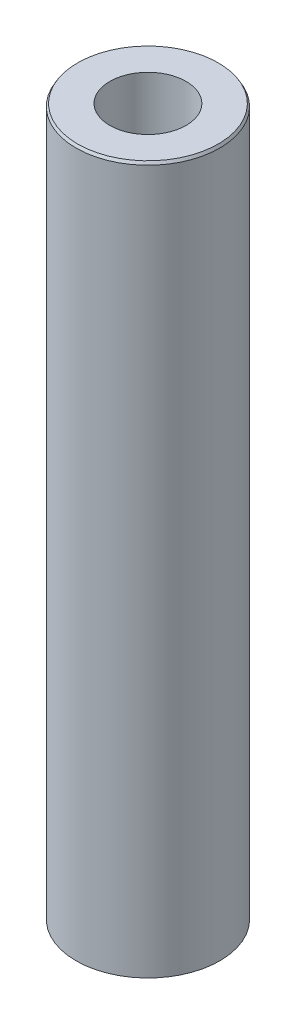
from build123d import *
from OCP.BRepFilletAPI import BRepFilletAPI_MakeChamfer

# Parameters (mm, degrees)
SKETCH1_R           = 47.5
BOSS_EXTRUDE1_DEPTH = 467.889511772
SKETCH2_R           = 25.213230245
CUT_EXTRUDE1_DEPTH  = 473.687100761
CHAMFER1_SIZE       = 1.798251149
CHAMFER1_SIZE2      = 1.038220785


with BuildPart() as part:
    # Sketch1 → Boss-Extrude1 (new body)
    with BuildSketch(Plane(origin=(0, 0, 0), x_dir=(1, 0, 0), z_dir=(0, 1, 0))):
        Circle(SKETCH1_R)
    extrude(amount=BOSS_EXTRUDE1_DEPTH)

    # Sketch2 → Cut-Extrude1 (cut, through all)
    with BuildSketch(Plane(origin=(0, 0, 0), x_dir=(1, 0, 0), z_dir=(0, 1, 0))):
        Circle(SKETCH2_R)
    extrude(amount=CUT_EXTRUDE1_DEPTH, mode=Mode.SUBTRACT)

    # Chamfer1: one chamfer whose edges measure the first distance from different faces: ONE call of the kernel's chamfer builder (chamfer() names one face for all edges)
    chamfer1_edges_1 = [part.edges().sort_by_distance(p)[0] for p in [
        (-47.5, 467.889511772, 0),
    ]]
    chamfer1_side_1 = [part.faces().sort_by_distance(p)[0] for p in [
        (-47.5, 233.944755886, 0),
    ]]
    chamfer1_edges_2 = [part.edges().sort_by_distance(p)[0] for p in [
        (-47.5, 0, 0),
    ]]
    chamfer1_side_2 = [part.faces().sort_by_distance(p)[0] for p in [
        (-46.156497116, 0, 0),
    ]]
    chamfer1 = BRepFilletAPI_MakeChamfer(part.part.solid().wrapped)
    for e in chamfer1_edges_1:
        chamfer1.Add(CHAMFER1_SIZE, CHAMFER1_SIZE2, e.wrapped, chamfer1_side_1[0].wrapped)  # the first distance lies on this face
    for e in chamfer1_edges_2:
        chamfer1.Add(CHAMFER1_SIZE, CHAMFER1_SIZE2, e.wrapped, chamfer1_side_2[0].wrapped)  # the first distance lies on this face
    add(Compound.cast(chamfer1.Shape()), mode=Mode.REPLACE)


solid = part.part
